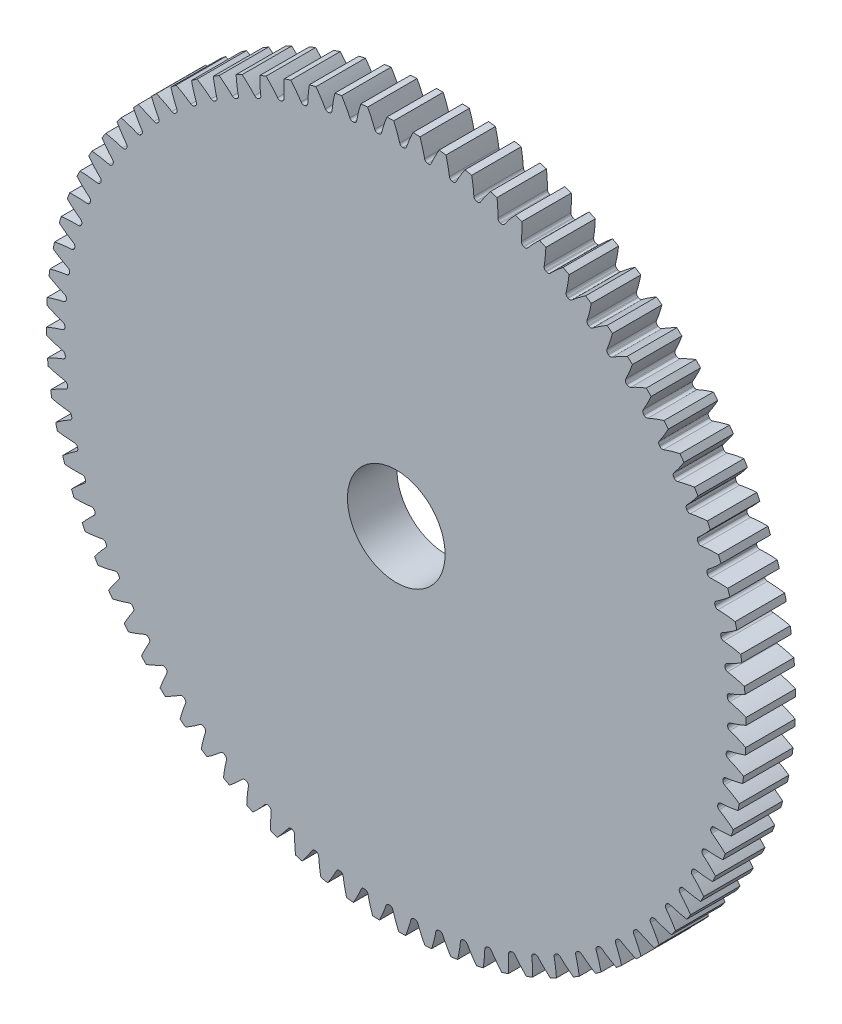
from build123d import *

# Parameters (mm, degrees)
SKETCH3_R         = 34.13125
GEARBODY_DEPTH    = 4.825999939
TOOTHCUT_DEPTH    = 49.509532347
CIRPATTERN1_COUNT = 84
BOREDIA_R         = 4.7625
BORE_DEPTH        = 12700


with BuildPart() as part:
    # Sketch3 → gearBody (new body)
    with BuildSketch(Plane.XY):
        Circle(SKETCH3_R)
    extrude(amount=GEARBODY_DEPTH)

    # Sketch2 → toothCut (cut, through all)
    with BuildSketch(Plane.XY):
        with BuildLine():
            ThreePointArc((32.326533325, -0.704082952), (32.327418705, -0.662185424), (32.328249782, -0.620286783))
            ThreePointArc((32.328249782, -0.620286783), (32.390621292, -0.441668016), (32.546630587, -0.334635456))
            ThreePointArc((32.546630587, -0.334635456), (36.489721676, 1.601622751), (39.549311826, 4.753760325))
            ThreePointArc((39.549311826, 4.753760325), (39.825630085, -0.8157766), (39.321469758, -6.36932643))
            ThreePointArc((39.321469758, -6.36932643), (36.393526806, -3.094541972), (32.533033461, -0.998437417))
            ThreePointArc((32.533033461, -0.998437417), (32.381538037, -0.885106019), (32.326533325, -0.704082952))
        make_face()
    toothcut = extrude(amount=TOOTHCUT_DEPTH, mode=Mode.SUBTRACT)

    # CirPattern1: toothCut ×84 about axis
    cirpattern1_axis = Axis((0, 0, 4.825999939), (0, 0, -1))
    for i in range(1, CIRPATTERN1_COUNT):
        add(toothcut.rotate(cirpattern1_axis, i * 360 / CIRPATTERN1_COUNT), mode=Mode.SUBTRACT)

    # boreDia → bore (cut, symmetric)
    with BuildSketch(Plane.XY):
        Circle(BOREDIA_R)
    extrude(amount=BORE_DEPTH, both=True, mode=Mode.SUBTRACT)


solid = part.part
